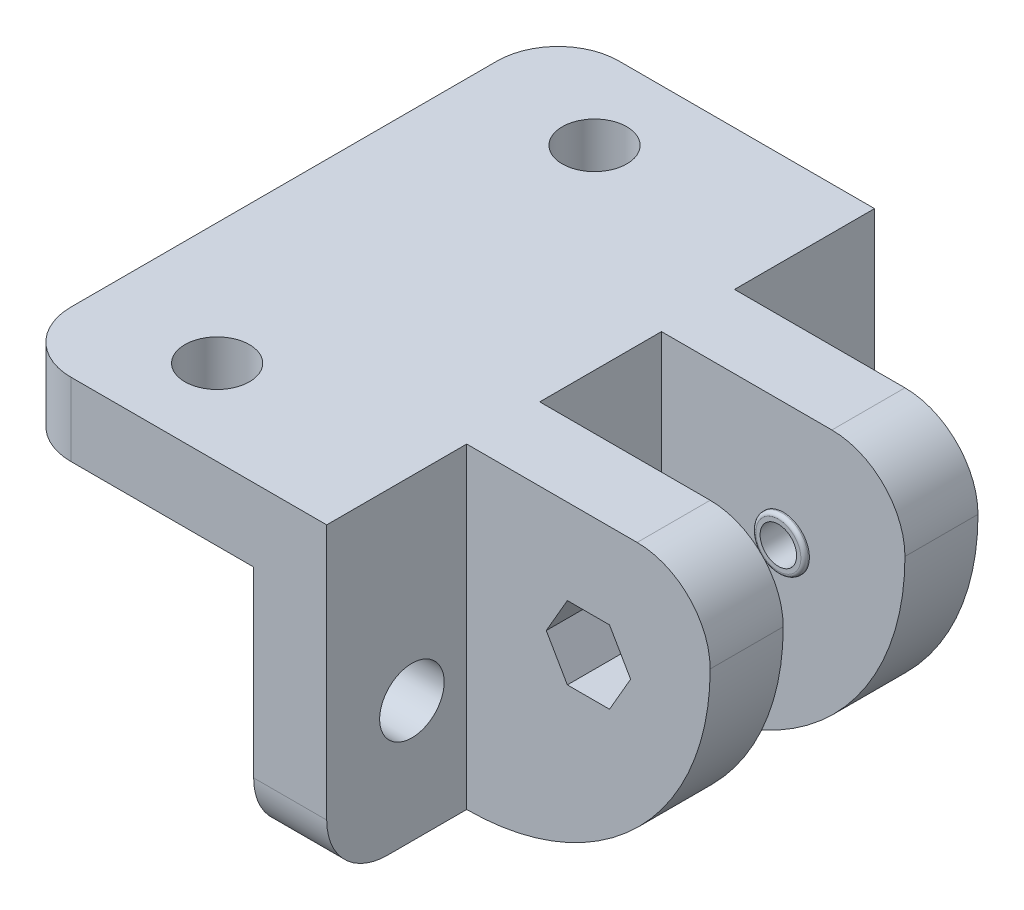
from build123d import *

# Parameters (mm, degrees)
SKETCH1_W           = 45
SKETCH1_H           = 6
BOSS_EXTRUDE1_DEPTH = 20
SKETCH2_W           = 6
SKETCH2_H           = 45
BOSS_EXTRUDE2_DEPTH = 26
SKETCH3_R           = 2.65
CUT_EXTRUDE1_DEPTH  = 26
SKETCH4_R           = 2.65
CUT_EXTRUDE2_DEPTH  = 26
FILLET1_R           = 5
SKETCH5_W           = 6
SKETCH5_H           = 26
BOSS_EXTRUDE3_DEPTH = 20
SKETCH8_R           = 2.15
BOSS_EXTRUDE6_DEPTH = 0.4
BOSS_EXTRUDE5_START = 0.4
SKETCH7_R           = 2.15
BOSS_EXTRUDE5_DEPTH = 0.4
SKETCH6_R           = 1.5
CUT_EXTRUDE3_DEPTH  = 47.885498824
FILLET2_R           = 20
FILLET3_R           = 6
FILLET4_R           = 0.3
FILLET5_R           = 0.3
CUT_EXTRUDE4_DEPTH  = 4.5


with BuildPart() as part:
    # Sketch1 → Boss-Extrude1 (new body)
    with BuildSketch(Plane(origin=(0, 0, 0), x_dir=(0, 0, -1), z_dir=(1, 0, 0))):
        with Locations((22.5, 3)):
            Rectangle(SKETCH1_W, SKETCH1_H)
    extrude(amount=-BOSS_EXTRUDE1_DEPTH)

    # Sketch2 → Boss-Extrude2 (add)
    with BuildSketch(Plane(origin=(0, 6, 0), x_dir=(1, 0, 0), z_dir=(0, 1, 0))):
        with Locations((3, 22.5)):
            Rectangle(SKETCH2_W, SKETCH2_H)
    extrude(amount=-BOSS_EXTRUDE2_DEPTH)

    # Sketch3 → Cut-Extrude1 (cut)
    with BuildSketch(Plane(origin=(0, 6, 0), x_dir=(1, 0, 0), z_dir=(0, 1, 0))):
        with Locations(Location((-10, 7, 0), (0, 0, 270))):
            Circle(SKETCH3_R)
        with Locations(Location((-10, 38, 0), (0, 0, 270))):
            Circle(SKETCH3_R)
    extrude(amount=-CUT_EXTRUDE1_DEPTH, mode=Mode.SUBTRACT)

    # Sketch4 → Cut-Extrude2 (cut)
    with BuildSketch(Plane(origin=(6, 0, 0), x_dir=(0, 0, -1), z_dir=(1, 0, 0))):
        with Locations((7, -10)):
            Circle(SKETCH4_R)
        with Locations((38, -10)):
            Circle(SKETCH4_R)
    extrude(amount=-CUT_EXTRUDE2_DEPTH, mode=Mode.SUBTRACT)

    # Fillet1
    fillet1_edges = [part.edges().sort_by_distance(p)[0] for p in [
        (-20, 3, -45),
        (3, -20, -45),
        (3, -20, 0),
        (-20, 3, 0),
    ]]
    fillet(fillet1_edges, radius=FILLET1_R)

    # Sketch5 → Boss-Extrude3 (add)
    with BuildSketch(Plane(origin=(6, 0, 0), x_dir=(0, 0, -1), z_dir=(1, 0, 0))):
        with Locations((30.5, -7)):
            Rectangle(SKETCH5_W, SKETCH5_H)
        with Locations((14.5, -7)):
            Rectangle(SKETCH5_W, SKETCH5_H)
    extrude(amount=BOSS_EXTRUDE3_DEPTH)

    # Sketch8 → Boss-Extrude6 (add)
    with BuildSketch(Plane.XY.offset(-27.5)):
        with Locations(Location((16, -4, 0), (0, 0, 90))):
            Circle(SKETCH8_R)
    extrude(amount=BOSS_EXTRUDE6_DEPTH)

    # Sketch7 → Boss-Extrude5 (add)
    with BuildSketch(Plane(origin=(0, 0, -17.5), x_dir=(-1, 0, 0), z_dir=(0, 0, -1)).offset(BOSS_EXTRUDE5_START)):
        with Locations(Location((-16, -4, 0), (0, 0, 90))):
            Circle(SKETCH7_R)
    extrude(amount=-BOSS_EXTRUDE5_DEPTH)

    # Sketch6 → Cut-Extrude3 (cut, through all)
    with BuildSketch(Plane.XY.offset(-11.5)):
        with Locations((16, -4)):
            Circle(SKETCH6_R)
    extrude(amount=-CUT_EXTRUDE3_DEPTH, mode=Mode.SUBTRACT)

    # Fillet2
    fillet2_edges = [part.edges().sort_by_distance(p)[0] for p in [
        (26, -20, -14.5),
        (26, -20, -30.5),
    ]]
    fillet(fillet2_edges, radius=FILLET2_R)

    # Fillet3
    fillet3_edges = [part.edges().sort_by_distance(p)[0] for p in [
        (26, 6, -14.5),
        (26, 6, -30.5),
    ]]
    fillet(fillet3_edges, radius=FILLET3_R - 0.0001)  # a hair under: the kernel refuses the full size

    # Fillet4
    fillet4_edges = [part.edges().sort_by_distance(p)[0] for p in [
        (16, -6.15, -27.1),
    ]]
    fillet(fillet4_edges, radius=FILLET4_R)

    # Fillet5
    fillet5_edges = [part.edges().sort_by_distance(p)[0] for p in [
        (16, -6.15, -17.9),
    ]]
    fillet(fillet5_edges, radius=FILLET5_R)

    # Sketch9 → Cut-Extrude4 (cut)
    with BuildSketch(Plane.XY.offset(-11.5)):
        Polygon((14.267949192, -1), (12.535898385, -4), (14.267949192, -7), (17.732050808, -7), (19.464101615, -4), (17.732050808, -1), align=None)
    extrude(amount=-CUT_EXTRUDE4_DEPTH, mode=Mode.SUBTRACT)


solid = part.part
